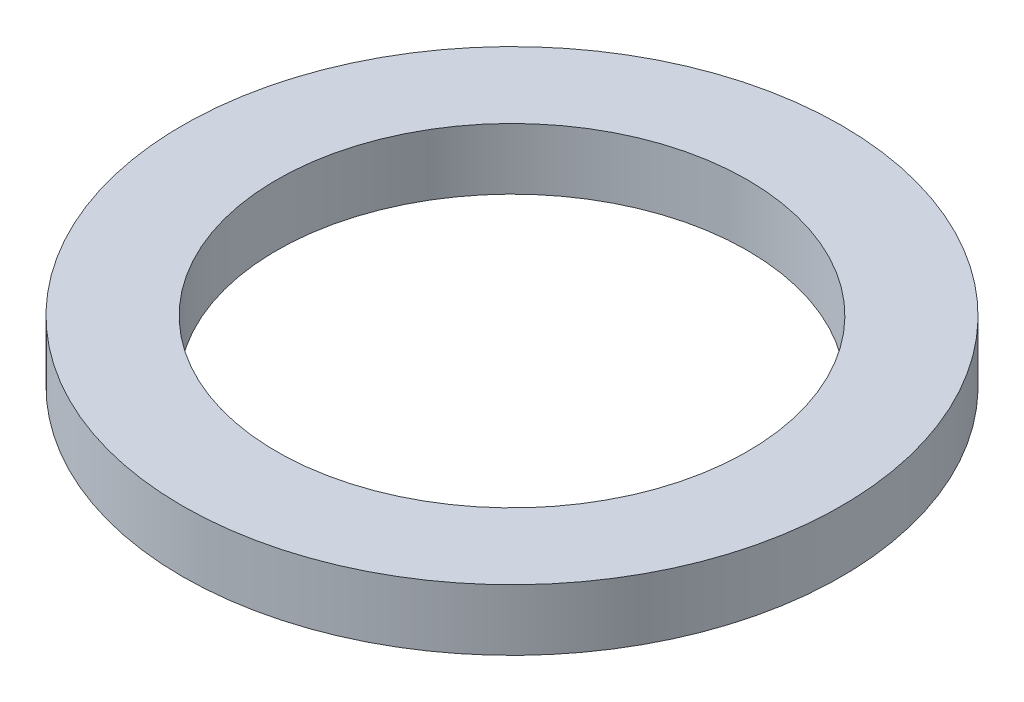
from build123d import *

# Parameters (mm, degrees)
SKETCH1_R           = 70
BOSS_EXTRUDE1_DEPTH = 13
SKETCH2_R           = 50
CUT_EXTRUDE1_DEPTH  = 100.844879688


with BuildPart() as part:
    # Sketch1 → Boss-Extrude1 (new body)
    with BuildSketch(Plane(origin=(0, 0, 0), x_dir=(1, 0, 0), z_dir=(0, 1, 0))):
        Circle(SKETCH1_R)
    extrude(amount=BOSS_EXTRUDE1_DEPTH)

    # Sketch2 → Cut-Extrude1 (cut, through all)
    with BuildSketch(Plane(origin=(0, 0, 0), x_dir=(1, 0, 0), z_dir=(0, 1, 0))):
        Circle(SKETCH2_R)
    extrude(amount=CUT_EXTRUDE1_DEPTH, mode=Mode.SUBTRACT)


solid = part.part
